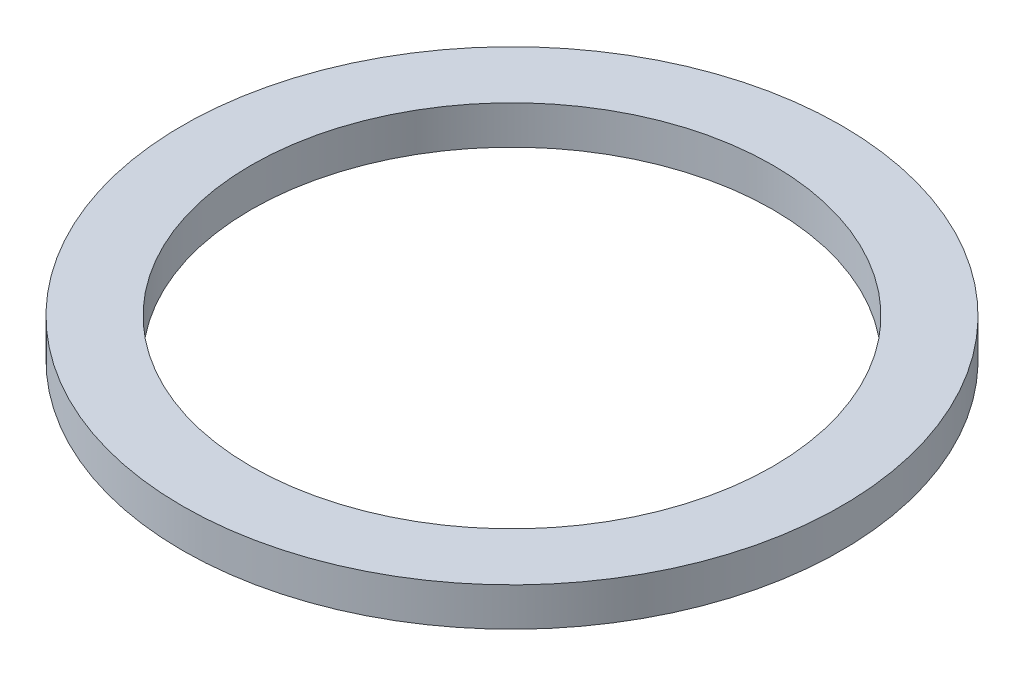
from build123d import *

# Parameters (mm, degrees)
SKETCH1_R           = 60
BOSS_EXTRUDE1_DEPTH = 7
SKETCH2_R           = 47.5
CUT_EXTRUDE1_DEPTH  = 86.141059425


with BuildPart() as part:
    # Sketch1 → Boss-Extrude1 (new body)
    with BuildSketch(Plane(origin=(0, 0, 0), x_dir=(1, 0, 0), z_dir=(0, 1, 0))):
        Circle(SKETCH1_R)
    extrude(amount=BOSS_EXTRUDE1_DEPTH)

    # Sketch2 → Cut-Extrude1 (cut, through all)
    with BuildSketch(Plane(origin=(0, 0, 0), x_dir=(1, 0, 0), z_dir=(0, 1, 0))):
        Circle(SKETCH2_R)
    extrude(amount=CUT_EXTRUDE1_DEPTH, mode=Mode.SUBTRACT)


solid = part.part
